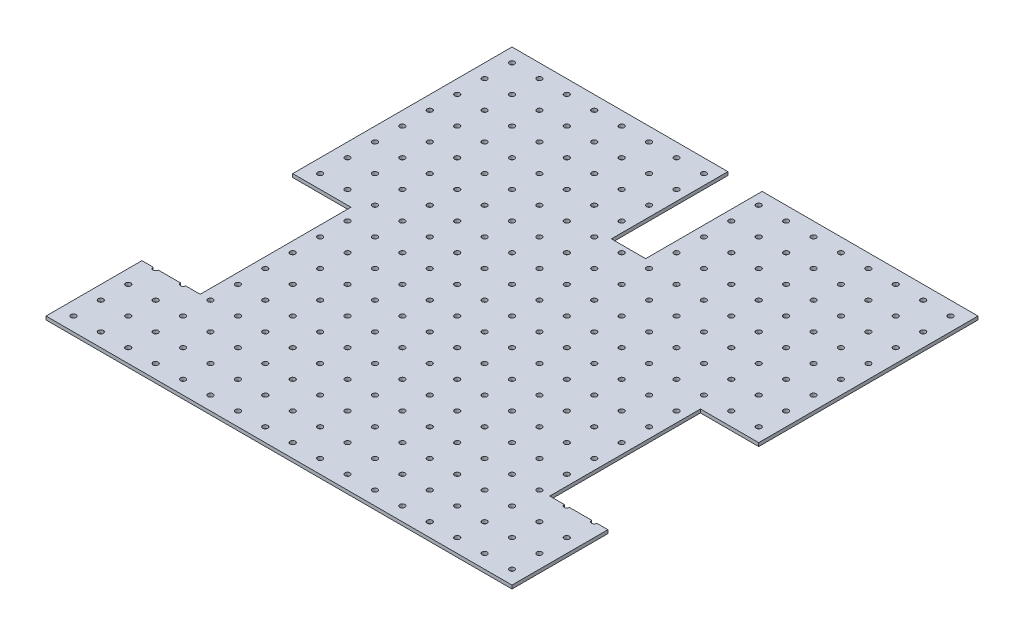
from build123d import *

# Parameters (mm, degrees)
SKETCH1_W           = 431.8
SKETCH1_H           = 431.8
BOSS_EXTRUDE1_DEPTH = 3.175
SKETCH2_R           = 2.38125
CUT_EXTRUDE1_DEPTH  = 3.175
SKETCH3_W           = 107.95
SKETCH3_H           = 139.7
CUT_EXTRUDE2_DEPTH  = 306.345215494
SKETCH5_W           = 31.75
SKETCH5_H           = 215.9
CUT_EXTRUDE3_DEPTH  = 306.345215494


with BuildPart() as part:
    # Sketch1 → Boss-Extrude1 (new body)
    with BuildSketch(Plane(origin=(0, 0, 0), x_dir=(1, 0, 0), z_dir=(0, 1, 0))):
        Rectangle(SKETCH1_W, SKETCH1_H)
    extrude(amount=BOSS_EXTRUDE1_DEPTH)

    # Sketch2 → Cut-Extrude1 (cut)
    with BuildSketch(Plane(origin=(0, 3.175, 0), x_dir=(1, 0, 0), z_dir=(0, 1, 0))):
        with Locations(Location((-203.2, -203.2, 0), (0, 0, 270))):
            Circle(SKETCH2_R)
        with Locations(Location((-177.8, -203.2, 0), (0, 0, 270))):
            Circle(SKETCH2_R)
        with Locations(Location((-152.4, -203.2, 0), (0, 0, 270))):
            Circle(SKETCH2_R)
        with Locations(Location((-127, -203.2, 0), (0, 0, 270))):
            Circle(SKETCH2_R)
        with Locations(Location((-101.6, -203.2, 0), (0, 0, 270))):
            Circle(SKETCH2_R)
        with Locations(Location((-76.2, -203.2, 0), (0, 0, 270))):
            Circle(SKETCH2_R)
        with Locations(Location((-50.8, -203.2, 0), (0, 0, 270))):
            Circle(SKETCH2_R)
        with Locations(Location((-25.4, -203.2, 0), (0, 0, 270))):
            Circle(SKETCH2_R)
        with Locations(Location((0, -203.2, 0), (0, 0, 270))):
            Circle(SKETCH2_R)
        with Locations(Location((25.4, -203.2, 0), (0, 0, 270))):
            Circle(SKETCH2_R)
        with Locations(Location((50.8, -203.2, 0), (0, 0, 270))):
            Circle(SKETCH2_R)
        with Locations(Location((76.2, -203.2, 0), (0, 0, 270))):
            Circle(SKETCH2_R)
        with Locations(Location((101.6, -203.2, 0), (0, 0, 270))):
            Circle(SKETCH2_R)
        with Locations(Location((127, -203.2, 0), (0, 0, 270))):
            Circle(SKETCH2_R)
        with Locations(Location((152.4, -203.2, 0), (0, 0, 270))):
            Circle(SKETCH2_R)
        with Locations(Location((177.8, -203.2, 0), (0, 0, 270))):
            Circle(SKETCH2_R)
        with Locations(Location((-177.8, -177.8, 0), (0, 0, 270))):
            Circle(SKETCH2_R)
        with Locations(Location((-152.4, -177.8, 0), (0, 0, 270))):
            Circle(SKETCH2_R)
        with Locations(Location((-127, -177.8, 0), (0, 0, 270))):
            Circle(SKETCH2_R)
        with Locations(Location((-101.6, -177.8, 0), (0, 0, 270))):
            Circle(SKETCH2_R)
        with Locations(Location((-76.2, -177.8, 0), (0, 0, 270))):
            Circle(SKETCH2_R)
        with Locations(Location((-50.8, -177.8, 0), (0, 0, 270))):
            Circle(SKETCH2_R)
        with Locations(Location((-25.4, -177.8, 0), (0, 0, 270))):
            Circle(SKETCH2_R)
        with Locations(Location((0, -177.8, 0), (0, 0, 270))):
            Circle(SKETCH2_R)
        with Locations(Location((25.4, -177.8, 0), (0, 0, 270))):
            Circle(SKETCH2_R)
        with Locations(Location((50.8, -177.8, 0), (0, 0, 270))):
            Circle(SKETCH2_R)
        with Locations(Location((76.2, -177.8, 0), (0, 0, 270))):
            Circle(SKETCH2_R)
        with Locations(Location((101.6, -177.8, 0), (0, 0, 270))):
            Circle(SKETCH2_R)
        with Locations(Location((127, -177.8, 0), (0, 0, 270))):
            Circle(SKETCH2_R)
        with Locations(Location((152.4, -177.8, 0), (0, 0, 270))):
            Circle(SKETCH2_R)
        with Locations(Location((177.8, -177.8, 0), (0, 0, 270))):
            Circle(SKETCH2_R)
        with Locations(Location((-177.8, -152.4, 0), (0, 0, 270))):
            Circle(SKETCH2_R)
        with Locations(Location((-152.4, -152.4, 0), (0, 0, 270))):
            Circle(SKETCH2_R)
        with Locations(Location((-127, -152.4, 0), (0, 0, 270))):
            Circle(SKETCH2_R)
        with Locations(Location((-101.6, -152.4, 0), (0, 0, 270))):
            Circle(SKETCH2_R)
        with Locations(Location((-76.2, -152.4, 0), (0, 0, 270))):
            Circle(SKETCH2_R)
        with Locations(Location((-50.8, -152.4, 0), (0, 0, 270))):
            Circle(SKETCH2_R)
        with Locations(Location((-25.4, -152.4, 0), (0, 0, 270))):
            Circle(SKETCH2_R)
        with Locations(Location((0, -152.4, 0), (0, 0, 270))):
            Circle(SKETCH2_R)
        with Locations(Location((25.4, -152.4, 0), (0, 0, 270))):
            Circle(SKETCH2_R)
        with Locations(Location((50.8, -152.4, 0), (0, 0, 270))):
            Circle(SKETCH2_R)
        with Locations(Location((76.2, -152.4, 0), (0, 0, 270))):
            Circle(SKETCH2_R)
        with Locations(Location((101.6, -152.4, 0), (0, 0, 270))):
            Circle(SKETCH2_R)
        with Locations(Location((127, -152.4, 0), (0, 0, 270))):
            Circle(SKETCH2_R)
        with Locations(Location((152.4, -152.4, 0), (0, 0, 270))):
            Circle(SKETCH2_R)
        with Locations(Location((177.8, -152.4, 0), (0, 0, 270))):
            Circle(SKETCH2_R)
        with Locations(Location((-177.8, -127, 0), (0, 0, 270))):
            Circle(SKETCH2_R)
        with Locations(Location((-152.4, -127, 0), (0, 0, 270))):
            Circle(SKETCH2_R)
        with Locations(Location((-127, -127, 0), (0, 0, 270))):
            Circle(SKETCH2_R)
        with Locations(Location((-101.6, -127, 0), (0, 0, 270))):
            Circle(SKETCH2_R)
        with Locations(Location((-76.2, -127, 0), (0, 0, 270))):
            Circle(SKETCH2_R)
        with Locations(Location((-50.8, -127, 0), (0, 0, 270))):
            Circle(SKETCH2_R)
        with Locations(Location((-25.4, -127, 0), (0, 0, 270))):
            Circle(SKETCH2_R)
        with Locations(Location((0, -127, 0), (0, 0, 270))):
            Circle(SKETCH2_R)
        with Locations(Location((25.4, -127, 0), (0, 0, 270))):
            Circle(SKETCH2_R)
        with Locations(Location((50.8, -127, 0), (0, 0, 270))):
            Circle(SKETCH2_R)
        with Locations(Location((76.2, -127, 0), (0, 0, 270))):
            Circle(SKETCH2_R)
        with Locations(Location((101.6, -127, 0), (0, 0, 270))):
            Circle(SKETCH2_R)
        with Locations(Location((127, -127, 0), (0, 0, 270))):
            Circle(SKETCH2_R)
        with Locations(Location((152.4, -127, 0), (0, 0, 270))):
            Circle(SKETCH2_R)
        with Locations(Location((177.8, -127, 0), (0, 0, 270))):
            Circle(SKETCH2_R)
        with Locations(Location((-177.8, -101.6, 0), (0, 0, 270))):
            Circle(SKETCH2_R)
        with Locations(Location((-152.4, -101.6, 0), (0, 0, 270))):
            Circle(SKETCH2_R)
        with Locations(Location((-127, -101.6, 0), (0, 0, 270))):
            Circle(SKETCH2_R)
        with Locations(Location((-101.6, -101.6, 0), (0, 0, 270))):
            Circle(SKETCH2_R)
        with Locations(Location((-76.2, -101.6, 0), (0, 0, 270))):
            Circle(SKETCH2_R)
        with Locations(Location((-50.8, -101.6, 0), (0, 0, 270))):
            Circle(SKETCH2_R)
        with Locations(Location((-25.4, -101.6, 0), (0, 0, 270))):
            Circle(SKETCH2_R)
        with Locations(Location((0, -101.6, 0), (0, 0, 270))):
            Circle(SKETCH2_R)
        with Locations(Location((25.4, -101.6, 0), (0, 0, 270))):
            Circle(SKETCH2_R)
        with Locations(Location((50.8, -101.6, 0), (0, 0, 270))):
            Circle(SKETCH2_R)
        with Locations(Location((76.2, -101.6, 0), (0, 0, 270))):
            Circle(SKETCH2_R)
        with Locations(Location((101.6, -101.6, 0), (0, 0, 270))):
            Circle(SKETCH2_R)
        with Locations(Location((127, -101.6, 0), (0, 0, 270))):
            Circle(SKETCH2_R)
        with Locations(Location((152.4, -101.6, 0), (0, 0, 270))):
            Circle(SKETCH2_R)
        with Locations(Location((177.8, -101.6, 0), (0, 0, 270))):
            Circle(SKETCH2_R)
        with Locations(Location((-177.8, -76.2, 0), (0, 0, 270))):
            Circle(SKETCH2_R)
        with Locations(Location((-152.4, -76.2, 0), (0, 0, 270))):
            Circle(SKETCH2_R)
        with Locations(Location((-127, -76.2, 0), (0, 0, 270))):
            Circle(SKETCH2_R)
        with Locations(Location((-101.6, -76.2, 0), (0, 0, 270))):
            Circle(SKETCH2_R)
        with Locations(Location((-76.2, -76.2, 0), (0, 0, 270))):
            Circle(SKETCH2_R)
        with Locations(Location((-50.8, -76.2, 0), (0, 0, 270))):
            Circle(SKETCH2_R)
        with Locations(Location((-25.4, -76.2, 0), (0, 0, 270))):
            Circle(SKETCH2_R)
        with Locations(Location((0, -76.2, 0), (0, 0, 270))):
            Circle(SKETCH2_R)
        with Locations(Location((25.4, -76.2, 0), (0, 0, 270))):
            Circle(SKETCH2_R)
        with Locations(Location((50.8, -76.2, 0), (0, 0, 270))):
            Circle(SKETCH2_R)
        with Locations(Location((76.2, -76.2, 0), (0, 0, 270))):
            Circle(SKETCH2_R)
        with Locations(Location((101.6, -76.2, 0), (0, 0, 270))):
            Circle(SKETCH2_R)
        with Locations(Location((127, -76.2, 0), (0, 0, 270))):
            Circle(SKETCH2_R)
        with Locations(Location((152.4, -76.2, 0), (0, 0, 270))):
            Circle(SKETCH2_R)
        with Locations(Location((177.8, -76.2, 0), (0, 0, 270))):
            Circle(SKETCH2_R)
        with Locations(Location((-177.8, -50.8, 0), (0, 0, 270))):
            Circle(SKETCH2_R)
        with Locations(Location((-152.4, -50.8, 0), (0, 0, 270))):
            Circle(SKETCH2_R)
        with Locations(Location((-127, -50.8, 0), (0, 0, 270))):
            Circle(SKETCH2_R)
        with Locations(Location((-101.6, -50.8, 0), (0, 0, 270))):
            Circle(SKETCH2_R)
        with Locations(Location((-76.2, -50.8, 0), (0, 0, 270))):
            Circle(SKETCH2_R)
        with Locations(Location((-50.8, -50.8, 0), (0, 0, 270))):
            Circle(SKETCH2_R)
        with Locations(Location((-25.4, -50.8, 0), (0, 0, 270))):
            Circle(SKETCH2_R)
        with Locations(Location((0, -50.8, 0), (0, 0, 270))):
            Circle(SKETCH2_R)
        with Locations(Location((25.4, -50.8, 0), (0, 0, 270))):
            Circle(SKETCH2_R)
        with Locations(Location((50.8, -50.8, 0), (0, 0, 270))):
            Circle(SKETCH2_R)
        with Locations(Location((76.2, -50.8, 0), (0, 0, 270))):
            Circle(SKETCH2_R)
        with Locations(Location((101.6, -50.8, 0), (0, 0, 270))):
            Circle(SKETCH2_R)
        with Locations(Location((127, -50.8, 0), (0, 0, 270))):
            Circle(SKETCH2_R)
        with Locations(Location((152.4, -50.8, 0), (0, 0, 270))):
            Circle(SKETCH2_R)
        with Locations(Location((177.8, -50.8, 0), (0, 0, 270))):
            Circle(SKETCH2_R)
        with Locations(Location((-177.8, -25.4, 0), (0, 0, 270))):
            Circle(SKETCH2_R)
        with Locations(Location((-152.4, -25.4, 0), (0, 0, 270))):
            Circle(SKETCH2_R)
        with Locations(Location((-127, -25.4, 0), (0, 0, 270))):
            Circle(SKETCH2_R)
        with Locations(Location((-101.6, -25.4, 0), (0, 0, 270))):
            Circle(SKETCH2_R)
        with Locations(Location((-76.2, -25.4, 0), (0, 0, 270))):
            Circle(SKETCH2_R)
        with Locations(Location((-50.8, -25.4, 0), (0, 0, 270))):
            Circle(SKETCH2_R)
        with Locations(Location((-25.4, -25.4, 0), (0, 0, 270))):
            Circle(SKETCH2_R)
        with Locations(Location((0, -25.4, 0), (0, 0, 270))):
            Circle(SKETCH2_R)
        with Locations(Location((25.4, -25.4, 0), (0, 0, 270))):
            Circle(SKETCH2_R)
        with Locations(Location((50.8, -25.4, 0), (0, 0, 270))):
            Circle(SKETCH2_R)
        with Locations(Location((76.2, -25.4, 0), (0, 0, 270))):
            Circle(SKETCH2_R)
        with Locations(Location((101.6, -25.4, 0), (0, 0, 270))):
            Circle(SKETCH2_R)
        with Locations(Location((127, -25.4, 0), (0, 0, 270))):
            Circle(SKETCH2_R)
        with Locations(Location((152.4, -25.4, 0), (0, 0, 270))):
            Circle(SKETCH2_R)
        with Locations(Location((177.8, -25.4, 0), (0, 0, 270))):
            Circle(SKETCH2_R)
        with Locations(Location((-177.8, 0, 0), (0, 0, 270))):
            Circle(SKETCH2_R)
        with Locations(Location((-152.4, 0, 0), (0, 0, 270))):
            Circle(SKETCH2_R)
        with Locations(Location((-127, 0, 0), (0, 0, 270))):
            Circle(SKETCH2_R)
        with Locations(Location((-101.6, 0, 0), (0, 0, 270))):
            Circle(SKETCH2_R)
        with Locations(Location((-76.2, 0, 0), (0, 0, 270))):
            Circle(SKETCH2_R)
        with Locations(Location((-50.8, 0, 0), (0, 0, 270))):
            Circle(SKETCH2_R)
        with Locations(Location((-25.4, 0, 0), (0, 0, 270))):
            Circle(SKETCH2_R)
        with Locations(Location((0, 0, 0), (0, 0, 270))):
            Circle(SKETCH2_R)
        with Locations(Location((25.4, 0, 0), (0, 0, 270))):
            Circle(SKETCH2_R)
        with Locations(Location((50.8, 0, 0), (0, 0, 270))):
            Circle(SKETCH2_R)
        with Locations(Location((76.2, 0, 0), (0, 0, 270))):
            Circle(SKETCH2_R)
        with Locations(Location((101.6, 0, 0), (0, 0, 270))):
            Circle(SKETCH2_R)
        with Locations(Location((127, 0, 0), (0, 0, 270))):
            Circle(SKETCH2_R)
        with Locations(Location((152.4, 0, 0), (0, 0, 270))):
            Circle(SKETCH2_R)
        with Locations(Location((177.8, 0, 0), (0, 0, 270))):
            Circle(SKETCH2_R)
        with Locations(Location((-177.8, 25.4, 0), (0, 0, 270))):
            Circle(SKETCH2_R)
        with Locations(Location((-152.4, 25.4, 0), (0, 0, 270))):
            Circle(SKETCH2_R)
        with Locations(Location((-127, 25.4, 0), (0, 0, 270))):
            Circle(SKETCH2_R)
        with Locations(Location((-101.6, 25.4, 0), (0, 0, 270))):
            Circle(SKETCH2_R)
        with Locations(Location((-76.2, 25.4, 0), (0, 0, 270))):
            Circle(SKETCH2_R)
        with Locations(Location((-50.8, 25.4, 0), (0, 0, 270))):
            Circle(SKETCH2_R)
        with Locations(Location((-25.4, 25.4, 0), (0, 0, 270))):
            Circle(SKETCH2_R)
        with Locations(Location((0, 25.4, 0), (0, 0, 270))):
            Circle(SKETCH2_R)
        with Locations(Location((25.4, 25.4, 0), (0, 0, 270))):
            Circle(SKETCH2_R)
        with Locations(Location((50.8, 25.4, 0), (0, 0, 270))):
            Circle(SKETCH2_R)
        with Locations(Location((76.2, 25.4, 0), (0, 0, 270))):
            Circle(SKETCH2_R)
        with Locations(Location((101.6, 25.4, 0), (0, 0, 270))):
            Circle(SKETCH2_R)
        with Locations(Location((127, 25.4, 0), (0, 0, 270))):
            Circle(SKETCH2_R)
        with Locations(Location((152.4, 25.4, 0), (0, 0, 270))):
            Circle(SKETCH2_R)
        with Locations(Location((177.8, 25.4, 0), (0, 0, 270))):
            Circle(SKETCH2_R)
        with Locations(Location((-177.8, 50.8, 0), (0, 0, 270))):
            Circle(SKETCH2_R)
        with Locations(Location((-152.4, 50.8, 0), (0, 0, 270))):
            Circle(SKETCH2_R)
        with Locations(Location((-127, 50.8, 0), (0, 0, 270))):
            Circle(SKETCH2_R)
        with Locations(Location((-101.6, 50.8, 0), (0, 0, 270))):
            Circle(SKETCH2_R)
        with Locations(Location((-76.2, 50.8, 0), (0, 0, 270))):
            Circle(SKETCH2_R)
        with Locations(Location((-50.8, 50.8, 0), (0, 0, 270))):
            Circle(SKETCH2_R)
        with Locations(Location((-25.4, 50.8, 0), (0, 0, 270))):
            Circle(SKETCH2_R)
        with Locations(Location((0, 50.8, 0), (0, 0, 270))):
            Circle(SKETCH2_R)
        with Locations(Location((25.4, 50.8, 0), (0, 0, 270))):
            Circle(SKETCH2_R)
        with Locations(Location((50.8, 50.8, 0), (0, 0, 270))):
            Circle(SKETCH2_R)
        with Locations(Location((76.2, 50.8, 0), (0, 0, 270))):
            Circle(SKETCH2_R)
        with Locations(Location((101.6, 50.8, 0), (0, 0, 270))):
            Circle(SKETCH2_R)
        with Locations(Location((127, 50.8, 0), (0, 0, 270))):
            Circle(SKETCH2_R)
        with Locations(Location((152.4, 50.8, 0), (0, 0, 270))):
            Circle(SKETCH2_R)
        with Locations(Location((177.8, 50.8, 0), (0, 0, 270))):
            Circle(SKETCH2_R)
        with Locations(Location((-177.8, 76.2, 0), (0, 0, 270))):
            Circle(SKETCH2_R)
        with Locations(Location((-152.4, 76.2, 0), (0, 0, 270))):
            Circle(SKETCH2_R)
        with Locations(Location((-127, 76.2, 0), (0, 0, 270))):
            Circle(SKETCH2_R)
        with Locations(Location((-101.6, 76.2, 0), (0, 0, 270))):
            Circle(SKETCH2_R)
        with Locations(Location((-76.2, 76.2, 0), (0, 0, 270))):
            Circle(SKETCH2_R)
        with Locations(Location((-50.8, 76.2, 0), (0, 0, 270))):
            Circle(SKETCH2_R)
        with Locations(Location((-25.4, 76.2, 0), (0, 0, 270))):
            Circle(SKETCH2_R)
        with Locations(Location((0, 76.2, 0), (0, 0, 270))):
            Circle(SKETCH2_R)
        with Locations(Location((25.4, 76.2, 0), (0, 0, 270))):
            Circle(SKETCH2_R)
        with Locations(Location((50.8, 76.2, 0), (0, 0, 270))):
            Circle(SKETCH2_R)
        with Locations(Location((76.2, 76.2, 0), (0, 0, 270))):
            Circle(SKETCH2_R)
        with Locations(Location((101.6, 76.2, 0), (0, 0, 270))):
            Circle(SKETCH2_R)
        with Locations(Location((127, 76.2, 0), (0, 0, 270))):
            Circle(SKETCH2_R)
        with Locations(Location((152.4, 76.2, 0), (0, 0, 270))):
            Circle(SKETCH2_R)
        with Locations(Location((177.8, 76.2, 0), (0, 0, 270))):
            Circle(SKETCH2_R)
        with Locations(Location((-177.8, 101.6, 0), (0, 0, 270))):
            Circle(SKETCH2_R)
        with Locations(Location((-152.4, 101.6, 0), (0, 0, 270))):
            Circle(SKETCH2_R)
        with Locations(Location((-127, 101.6, 0), (0, 0, 270))):
            Circle(SKETCH2_R)
        with Locations(Location((-101.6, 101.6, 0), (0, 0, 270))):
            Circle(SKETCH2_R)
        with Locations(Location((-76.2, 101.6, 0), (0, 0, 270))):
            Circle(SKETCH2_R)
        with Locations(Location((-50.8, 101.6, 0), (0, 0, 270))):
            Circle(SKETCH2_R)
        with Locations(Location((-25.4, 101.6, 0), (0, 0, 270))):
            Circle(SKETCH2_R)
        with Locations(Location((0, 101.6, 0), (0, 0, 270))):
            Circle(SKETCH2_R)
        with Locations(Location((25.4, 101.6, 0), (0, 0, 270))):
            Circle(SKETCH2_R)
        with Locations(Location((50.8, 101.6, 0), (0, 0, 270))):
            Circle(SKETCH2_R)
        with Locations(Location((76.2, 101.6, 0), (0, 0, 270))):
            Circle(SKETCH2_R)
        with Locations(Location((101.6, 101.6, 0), (0, 0, 270))):
            Circle(SKETCH2_R)
        with Locations(Location((127, 101.6, 0), (0, 0, 270))):
            Circle(SKETCH2_R)
        with Locations(Location((152.4, 101.6, 0), (0, 0, 270))):
            Circle(SKETCH2_R)
        with Locations(Location((177.8, 101.6, 0), (0, 0, 270))):
            Circle(SKETCH2_R)
        with Locations(Location((-177.8, 127, 0), (0, 0, 270))):
            Circle(SKETCH2_R)
        with Locations(Location((-152.4, 127, 0), (0, 0, 270))):
            Circle(SKETCH2_R)
        with Locations(Location((-127, 127, 0), (0, 0, 270))):
            Circle(SKETCH2_R)
        with Locations(Location((-101.6, 127, 0), (0, 0, 270))):
            Circle(SKETCH2_R)
        with Locations(Location((-76.2, 127, 0), (0, 0, 270))):
            Circle(SKETCH2_R)
        with Locations(Location((-50.8, 127, 0), (0, 0, 270))):
            Circle(SKETCH2_R)
        with Locations(Location((-25.4, 127, 0), (0, 0, 270))):
            Circle(SKETCH2_R)
        with Locations(Location((0, 127, 0), (0, 0, 270))):
            Circle(SKETCH2_R)
        with Locations(Location((25.4, 127, 0), (0, 0, 270))):
            Circle(SKETCH2_R)
        with Locations(Location((50.8, 127, 0), (0, 0, 270))):
            Circle(SKETCH2_R)
        with Locations(Location((76.2, 127, 0), (0, 0, 270))):
            Circle(SKETCH2_R)
        with Locations(Location((101.6, 127, 0), (0, 0, 270))):
            Circle(SKETCH2_R)
        with Locations(Location((127, 127, 0), (0, 0, 270))):
            Circle(SKETCH2_R)
        with Locations(Location((152.4, 127, 0), (0, 0, 270))):
            Circle(SKETCH2_R)
        with Locations(Location((177.8, 127, 0), (0, 0, 270))):
            Circle(SKETCH2_R)
        with Locations(Location((-177.8, 152.4, 0), (0, 0, 270))):
            Circle(SKETCH2_R)
        with Locations(Location((-152.4, 152.4, 0), (0, 0, 270))):
            Circle(SKETCH2_R)
        with Locations(Location((-127, 152.4, 0), (0, 0, 270))):
            Circle(SKETCH2_R)
        with Locations(Location((-101.6, 152.4, 0), (0, 0, 270))):
            Circle(SKETCH2_R)
        with Locations(Location((-76.2, 152.4, 0), (0, 0, 270))):
            Circle(SKETCH2_R)
        with Locations(Location((-50.8, 152.4, 0), (0, 0, 270))):
            Circle(SKETCH2_R)
        with Locations(Location((-25.4, 152.4, 0), (0, 0, 270))):
            Circle(SKETCH2_R)
        with Locations(Location((0, 152.4, 0), (0, 0, 270))):
            Circle(SKETCH2_R)
        with Locations(Location((25.4, 152.4, 0), (0, 0, 270))):
            Circle(SKETCH2_R)
        with Locations(Location((50.8, 152.4, 0), (0, 0, 270))):
            Circle(SKETCH2_R)
        with Locations(Location((76.2, 152.4, 0), (0, 0, 270))):
            Circle(SKETCH2_R)
        with Locations(Location((101.6, 152.4, 0), (0, 0, 270))):
            Circle(SKETCH2_R)
        with Locations(Location((127, 152.4, 0), (0, 0, 270))):
            Circle(SKETCH2_R)
        with Locations(Location((152.4, 152.4, 0), (0, 0, 270))):
            Circle(SKETCH2_R)
        with Locations(Location((177.8, 152.4, 0), (0, 0, 270))):
            Circle(SKETCH2_R)
        with Locations(Location((-177.8, 177.8, 0), (0, 0, 270))):
            Circle(SKETCH2_R)
        with Locations(Location((-152.4, 177.8, 0), (0, 0, 270))):
            Circle(SKETCH2_R)
        with Locations(Location((-127, 177.8, 0), (0, 0, 270))):
            Circle(SKETCH2_R)
        with Locations(Location((-101.6, 177.8, 0), (0, 0, 270))):
            Circle(SKETCH2_R)
        with Locations(Location((-76.2, 177.8, 0), (0, 0, 270))):
            Circle(SKETCH2_R)
        with Locations(Location((-50.8, 177.8, 0), (0, 0, 270))):
            Circle(SKETCH2_R)
        with Locations(Location((-25.4, 177.8, 0), (0, 0, 270))):
            Circle(SKETCH2_R)
        with Locations(Location((0, 177.8, 0), (0, 0, 270))):
            Circle(SKETCH2_R)
        with Locations(Location((25.4, 177.8, 0), (0, 0, 270))):
            Circle(SKETCH2_R)
        with Locations(Location((50.8, 177.8, 0), (0, 0, 270))):
            Circle(SKETCH2_R)
        with Locations(Location((76.2, 177.8, 0), (0, 0, 270))):
            Circle(SKETCH2_R)
        with Locations(Location((101.6, 177.8, 0), (0, 0, 270))):
            Circle(SKETCH2_R)
        with Locations(Location((127, 177.8, 0), (0, 0, 270))):
            Circle(SKETCH2_R)
        with Locations(Location((152.4, 177.8, 0), (0, 0, 270))):
            Circle(SKETCH2_R)
        with Locations(Location((177.8, 177.8, 0), (0, 0, 270))):
            Circle(SKETCH2_R)
        with Locations(Location((-203.2, -177.8, 0), (0, 0, 270))):
            Circle(SKETCH2_R)
        with Locations(Location((-203.2, -152.4, 0), (0, 0, 270))):
            Circle(SKETCH2_R)
        with Locations(Location((-203.2, -127, 0), (0, 0, 270))):
            Circle(SKETCH2_R)
        with Locations(Location((-203.2, -101.6, 0), (0, 0, 270))):
            Circle(SKETCH2_R)
        with Locations(Location((-203.2, -76.2, 0), (0, 0, 270))):
            Circle(SKETCH2_R)
        with Locations(Location((-203.2, -50.8, 0), (0, 0, 270))):
            Circle(SKETCH2_R)
        with Locations(Location((-203.2, -25.4, 0), (0, 0, 270))):
            Circle(SKETCH2_R)
        with Locations(Location((-203.2, 0, 0), (0, 0, 270))):
            Circle(SKETCH2_R)
        with Locations(Location((-203.2, 25.4, 0), (0, 0, 270))):
            Circle(SKETCH2_R)
        with Locations(Location((-203.2, 50.8, 0), (0, 0, 270))):
            Circle(SKETCH2_R)
        with Locations(Location((-203.2, 76.2, 0), (0, 0, 270))):
            Circle(SKETCH2_R)
        with Locations(Location((-203.2, 101.6, 0), (0, 0, 270))):
            Circle(SKETCH2_R)
        with Locations(Location((-203.2, 127, 0), (0, 0, 270))):
            Circle(SKETCH2_R)
        with Locations(Location((-203.2, 152.4, 0), (0, 0, 270))):
            Circle(SKETCH2_R)
        with Locations(Location((-203.2, 177.8, 0), (0, 0, 270))):
            Circle(SKETCH2_R)
        with Locations(Location((203.2, -203.2, 0), (0, 0, 270))):
            Circle(SKETCH2_R)
        with Locations(Location((203.2, -177.8, 0), (0, 0, 270))):
            Circle(SKETCH2_R)
        with Locations(Location((203.2, -152.4, 0), (0, 0, 270))):
            Circle(SKETCH2_R)
        with Locations(Location((203.2, -127, 0), (0, 0, 270))):
            Circle(SKETCH2_R)
        with Locations(Location((203.2, -101.6, 0), (0, 0, 270))):
            Circle(SKETCH2_R)
        with Locations(Location((203.2, -76.2, 0), (0, 0, 270))):
            Circle(SKETCH2_R)
        with Locations(Location((203.2, -50.8, 0), (0, 0, 270))):
            Circle(SKETCH2_R)
        with Locations(Location((203.2, -25.4, 0), (0, 0, 270))):
            Circle(SKETCH2_R)
        with Locations(Location((203.2, 0, 0), (0, 0, 270))):
            Circle(SKETCH2_R)
        with Locations(Location((203.2, 25.4, 0), (0, 0, 270))):
            Circle(SKETCH2_R)
        with Locations(Location((203.2, 50.8, 0), (0, 0, 270))):
            Circle(SKETCH2_R)
        with Locations(Location((203.2, 76.2, 0), (0, 0, 270))):
            Circle(SKETCH2_R)
        with Locations(Location((203.2, 101.6, 0), (0, 0, 270))):
            Circle(SKETCH2_R)
        with Locations(Location((203.2, 127, 0), (0, 0, 270))):
            Circle(SKETCH2_R)
        with Locations(Location((203.2, 152.4, 0), (0, 0, 270))):
            Circle(SKETCH2_R)
        with Locations(Location((203.2, 177.8, 0), (0, 0, 270))):
            Circle(SKETCH2_R)
        with Locations(Location((-203.2, 203.2, 0), (0, 0, 270))):
            Circle(SKETCH2_R)
        with Locations(Location((-177.8, 203.2, 0), (0, 0, 270))):
            Circle(SKETCH2_R)
        with Locations(Location((-152.4, 203.2, 0), (0, 0, 270))):
            Circle(SKETCH2_R)
        with Locations(Location((-127, 203.2, 0), (0, 0, 270))):
            Circle(SKETCH2_R)
        with Locations(Location((-101.6, 203.2, 0), (0, 0, 270))):
            Circle(SKETCH2_R)
        with Locations(Location((-76.2, 203.2, 0), (0, 0, 270))):
            Circle(SKETCH2_R)
        with Locations(Location((-50.8, 203.2, 0), (0, 0, 270))):
            Circle(SKETCH2_R)
        with Locations(Location((-25.4, 203.2, 0), (0, 0, 270))):
            Circle(SKETCH2_R)
        with Locations(Location((0, 203.2, 0), (0, 0, 270))):
            Circle(SKETCH2_R)
        with Locations(Location((25.4, 203.2, 0), (0, 0, 270))):
            Circle(SKETCH2_R)
        with Locations(Location((50.8, 203.2, 0), (0, 0, 270))):
            Circle(SKETCH2_R)
        with Locations(Location((76.2, 203.2, 0), (0, 0, 270))):
            Circle(SKETCH2_R)
        with Locations(Location((101.6, 203.2, 0), (0, 0, 270))):
            Circle(SKETCH2_R)
        with Locations(Location((127, 203.2, 0), (0, 0, 270))):
            Circle(SKETCH2_R)
        with Locations(Location((152.4, 203.2, 0), (0, 0, 270))):
            Circle(SKETCH2_R)
        with Locations(Location((177.8, 203.2, 0), (0, 0, 270))):
            Circle(SKETCH2_R)
        with Locations(Location((203.2, 203.2, 0), (0, 0, 270))):
            Circle(SKETCH2_R)
    extrude(amount=-CUT_EXTRUDE1_DEPTH, mode=Mode.SUBTRACT)

    # Sketch3 → Cut-Extrude2 (cut, through all)
    with BuildSketch(Plane(origin=(0, 3.175, 0), x_dir=(1, 0, 0), z_dir=(0, 1, 0))):
        with Locations((-215.9, -57.15)):
            Rectangle(SKETCH3_W, SKETCH3_H)
    cut_extrude2 = extrude(amount=-CUT_EXTRUDE2_DEPTH, mode=Mode.SUBTRACT)

    # Mirror1: Cut-Extrude2 across plane
    add(cut_extrude2.mirror(Plane(origin=(0, 0, 0), x_dir=(0, 0, 1), z_dir=(1, 0, 0))), mode=Mode.SUBTRACT)

    # Sketch5 → Cut-Extrude3 (cut, through all)
    with BuildSketch(Plane(origin=(0, 3.175, 0), x_dir=(1, 0, 0), z_dir=(0, 1, 0))):
        with Locations((0, 215.9)):
            Rectangle(SKETCH5_W, SKETCH5_H)
    extrude(amount=-CUT_EXTRUDE3_DEPTH, mode=Mode.SUBTRACT)


solid = part.part
